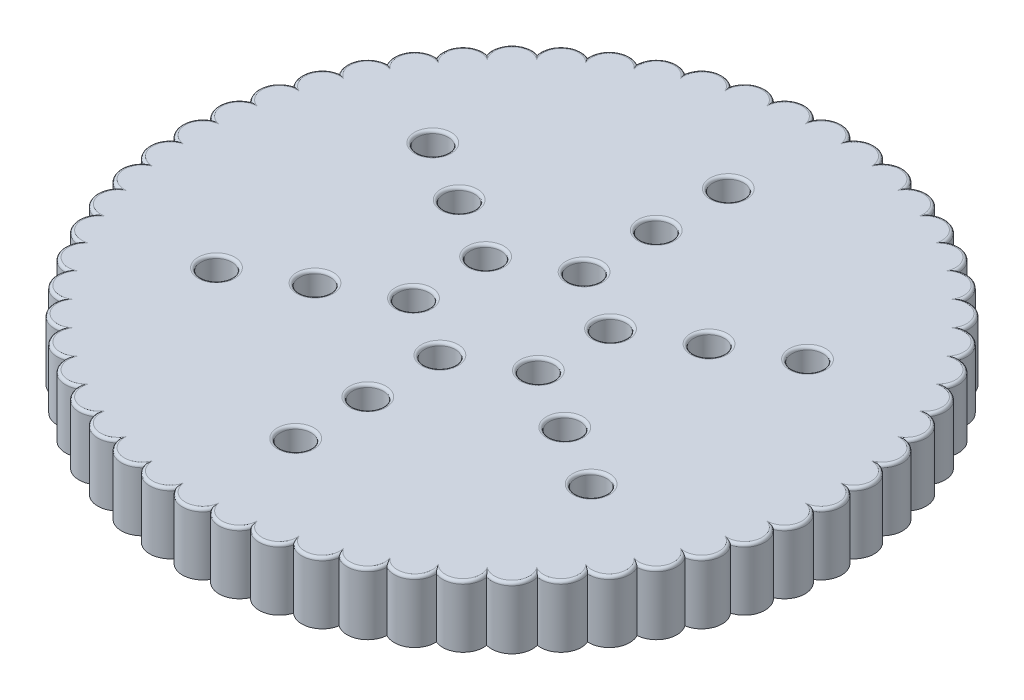
from build123d import *

# Parameters (mm, degrees)
SKETCH1_R           = 0.75
BOSS_EXTRUDE1_DEPTH = 3
FILLET3_R           = 0.14


with BuildPart() as part:
    # Sketch1 → Boss-Extrude1 (new body)
    with BuildSketch(Plane(origin=(0, 0, 0), x_dir=(1, 0, 0), z_dir=(0, 1, 0))):
        with BuildLine():
            ThreePointArc((-15.479945264, 0.869335079), (-15.993021116, 0), (-15.479945264, -0.869335079))
            ThreePointArc((-15.479945264, -0.869335079), (-15.892460356, -1.790650231), (-15.285275971, -2.597072844))
            ThreePointArc((-15.285275971, -2.597072844), (-15.592042686, -3.558781995), (-14.898385463, -4.292150911))
            ThreePointArc((-14.898385463, -4.292150911), (-15.095546032, -5.282160012), (-14.324139114, -5.93325269))
            ThreePointArc((-14.324139114, -5.93325269), (-14.409214129, -6.939111801), (-13.569758405, -7.499740374))
            ThreePointArc((-13.569758405, -7.499740374), (-13.541677997, -8.508800234), (-12.64473011, -8.971914472))
            ThreePointArc((-12.64473011, -8.971914472), (-12.503847408, -9.971485566), (-11.560686998, -10.331261539))
            ThreePointArc((-11.560686998, -10.331261539), (-11.308773682, -11.308773682), (-10.331261539, -11.560686998))
            ThreePointArc((-10.331261539, -11.560686998), (-9.971485566, -12.503847408), (-8.971914472, -12.64473011))
            ThreePointArc((-8.971914472, -12.64473011), (-8.508800234, -13.541677997), (-7.499740374, -13.569758405))
            ThreePointArc((-7.499740374, -13.569758405), (-6.939111801, -14.409214129), (-5.93325269, -14.324139114))
            ThreePointArc((-5.93325269, -14.324139114), (-5.282160012, -15.095546032), (-4.292150911, -14.898385463))
            ThreePointArc((-4.292150911, -14.898385463), (-3.558781995, -15.592042686), (-2.597072844, -15.285275971))
            ThreePointArc((-2.597072844, -15.285275971), (-1.790650231, -15.892460356), (-0.869335079, -15.479945264))
            ThreePointArc((-0.869335079, -15.479945264), (0, -15.993021116), (0.869335079, -15.479945264))
            ThreePointArc((0.869335079, -15.479945264), (1.790650231, -15.892460356), (2.597072844, -15.285275971))
            ThreePointArc((2.597072844, -15.285275971), (3.558781995, -15.592042686), (4.292150911, -14.898385463))
            ThreePointArc((4.292150911, -14.898385463), (5.282160012, -15.095546032), (5.93325269, -14.324139114))
            ThreePointArc((5.93325269, -14.324139114), (6.939111801, -14.409214129), (7.499740374, -13.569758405))
            ThreePointArc((7.499740374, -13.569758405), (8.508800234, -13.541677997), (8.971914472, -12.64473011))
            ThreePointArc((8.971914472, -12.64473011), (9.971485566, -12.503847408), (10.331261539, -11.560686998))
            ThreePointArc((10.331261539, -11.560686998), (11.308773682, -11.308773682), (11.560686998, -10.331261539))
            ThreePointArc((11.560686998, -10.331261539), (12.503847408, -9.971485566), (12.64473011, -8.971914472))
            ThreePointArc((12.64473011, -8.971914472), (13.541677997, -8.508800234), (13.569758405, -7.499740374))
            ThreePointArc((13.569758405, -7.499740374), (14.409214129, -6.939111801), (14.324139114, -5.93325269))
            ThreePointArc((14.324139114, -5.93325269), (15.095546032, -5.282160012), (14.898385463, -4.292150911))
            ThreePointArc((14.898385463, -4.292150911), (15.592042686, -3.558781995), (15.285275971, -2.597072844))
            ThreePointArc((15.285275971, -2.597072844), (15.892460356, -1.790650231), (15.479945264, -0.869335079))
            ThreePointArc((15.479945264, -0.869335079), (15.993021116, 0), (15.479945264, 0.869335079))
            ThreePointArc((15.479945264, 0.869335079), (15.892460356, 1.790650231), (15.285275971, 2.597072844))
            ThreePointArc((15.285275971, 2.597072844), (15.592042686, 3.558781995), (14.898385463, 4.292150911))
            ThreePointArc((14.898385463, 4.292150911), (15.095546032, 5.282160012), (14.324139114, 5.93325269))
            ThreePointArc((14.324139114, 5.93325269), (14.409214129, 6.939111801), (13.569758405, 7.499740374))
            ThreePointArc((13.569758405, 7.499740374), (13.541677997, 8.508800234), (12.64473011, 8.971914472))
            ThreePointArc((12.64473011, 8.971914472), (12.503847408, 9.971485566), (11.560686998, 10.331261539))
            ThreePointArc((11.560686998, 10.331261539), (11.308773682, 11.308773682), (10.331261539, 11.560686998))
            ThreePointArc((10.331261539, 11.560686998), (9.971485566, 12.503847408), (8.971914472, 12.64473011))
            ThreePointArc((8.971914472, 12.64473011), (8.508800234, 13.541677997), (7.499740374, 13.569758405))
            ThreePointArc((7.499740374, 13.569758405), (6.939111801, 14.409214129), (5.93325269, 14.324139114))
            ThreePointArc((5.93325269, 14.324139114), (5.282160012, 15.095546032), (4.292150911, 14.898385463))
            ThreePointArc((4.292150911, 14.898385463), (3.558781995, 15.592042686), (2.597072844, 15.285275971))
            ThreePointArc((2.597072844, 15.285275971), (1.790650231, 15.892460356), (0.869335079, 15.479945264))
            ThreePointArc((0.869335079, 15.479945264), (0, 15.993021116), (-0.869335079, 15.479945264))
            ThreePointArc((-0.869335079, 15.479945264), (-1.790650231, 15.892460356), (-2.597072844, 15.285275971))
            ThreePointArc((-2.597072844, 15.285275971), (-3.558781995, 15.592042686), (-4.292150911, 14.898385463))
            ThreePointArc((-4.292150911, 14.898385463), (-5.282160012, 15.095546032), (-5.93325269, 14.324139114))
            ThreePointArc((-5.93325269, 14.324139114), (-6.939111801, 14.409214129), (-7.499740374, 13.569758405))
            ThreePointArc((-7.499740374, 13.569758405), (-8.508800234, 13.541677997), (-8.971914472, 12.64473011))
            ThreePointArc((-8.971914472, 12.64473011), (-9.971485566, 12.503847408), (-10.331261539, 11.560686998))
            ThreePointArc((-10.331261539, 11.560686998), (-11.308773682, 11.308773682), (-11.560686998, 10.331261539))
            ThreePointArc((-11.560686998, 10.331261539), (-12.503847408, 9.971485566), (-12.64473011, 8.971914472))
            ThreePointArc((-12.64473011, 8.971914472), (-13.541677997, 8.508800234), (-13.569758405, 7.499740374))
            ThreePointArc((-13.569758405, 7.499740374), (-14.409214129, 6.939111801), (-14.324139114, 5.93325269))
            ThreePointArc((-14.324139114, 5.93325269), (-15.095546032, 5.282160012), (-14.898385463, 4.292150911))
            ThreePointArc((-14.898385463, 4.292150911), (-15.592042686, 3.558781995), (-15.285275971, 2.597072844))
            ThreePointArc((-15.285275971, 2.597072844), (-15.892460356, 1.790650231), (-15.479945264, 0.869335079))
        make_face()
        with Locations((0, 10.5)):
            Circle(SKETCH1_R, mode=Mode.SUBTRACT)
        with Locations((0, 7)):
            Circle(SKETCH1_R, mode=Mode.SUBTRACT)
        with Locations((0, 3.5)):
            Circle(SKETCH1_R, mode=Mode.SUBTRACT)
        with Locations((3.031088913, 1.75)):
            Circle(SKETCH1_R, mode=Mode.SUBTRACT)
        with Locations((6.062177826, 3.5)):
            Circle(SKETCH1_R, mode=Mode.SUBTRACT)
        with Locations((9.09326674, 5.25)):
            Circle(SKETCH1_R, mode=Mode.SUBTRACT)
        with Locations((3.031088913, -1.75)):
            Circle(SKETCH1_R, mode=Mode.SUBTRACT)
        with Locations((6.062177826, -3.5)):
            Circle(SKETCH1_R, mode=Mode.SUBTRACT)
        with Locations((9.09326674, -5.25)):
            Circle(SKETCH1_R, mode=Mode.SUBTRACT)
        with Locations((0, -3.5)):
            Circle(SKETCH1_R, mode=Mode.SUBTRACT)
        with Locations((0, -7)):
            Circle(SKETCH1_R, mode=Mode.SUBTRACT)
        with Locations((0, -10.5)):
            Circle(SKETCH1_R, mode=Mode.SUBTRACT)
        with Locations((-3.031088913, -1.75)):
            Circle(SKETCH1_R, mode=Mode.SUBTRACT)
        with Locations((-6.062177826, -3.5)):
            Circle(SKETCH1_R, mode=Mode.SUBTRACT)
        with Locations((-9.09326674, -5.25)):
            Circle(SKETCH1_R, mode=Mode.SUBTRACT)
        with Locations((-3.031088913, 1.75)):
            Circle(SKETCH1_R, mode=Mode.SUBTRACT)
        with Locations((-6.062177826, 3.5)):
            Circle(SKETCH1_R, mode=Mode.SUBTRACT)
        with Locations((-9.09326674, 5.25)):
            Circle(SKETCH1_R, mode=Mode.SUBTRACT)
    extrude(amount=BOSS_EXTRUDE1_DEPTH)

    # Fillet3
    fillet3_edges = [part.edges().sort_by_distance(p)[0] for p in [
        (-3.781088913, 3, -1.75),
        (-9.84326674, 3, -5.25),
        (-6.812177826, 3, 3.5),
        (-0.75, 3, 3.5),
        (-0.75, 3, 10.5),
        (5.312177826, 3, 3.5),
        (2.281088913, 3, -1.75),
        (8.34326674, 3, -5.25),
        (-0.75, 3, -7),
        (-15.993021116, 3, 0),
        (-15.892460356, 3, -1.790650231),
        (-15.592042686, 3, -3.558781995),
        (-15.095546032, 3, -5.282160012),
        (-14.409214129, 3, -6.939111801),
        (-13.541677997, 3, -8.508800234),
        (-12.503847408, 3, -9.971485566),
        (-11.308773682, 3, -11.308773682),
        (-9.971485566, 3, -12.503847408),
        (-8.508800234, 3, -13.541677997),
        (-6.939111801, 3, -14.409214129),
        (-5.282160012, 3, -15.095546032),
        (-3.558781995, 3, -15.592042686),
        (-1.790650231, 3, -15.892460356),
        (0, 3, -15.993021116),
        (1.790650231, 3, -15.892460356),
        (3.558781995, 3, -15.592042686),
        (5.282160012, 3, -15.095546032),
        (6.939111801, 3, -14.409214129),
        (8.508800234, 3, -13.541677997),
        (9.971485566, 3, -12.503847408),
        (11.308773682, 3, -11.308773682),
        (12.503847408, 3, -9.971485566),
        (13.541677997, 3, -8.508800234),
        (14.409214129, 3, -6.939111801),
        (15.095546032, 3, -5.282160012),
        (15.592042686, 3, -3.558781995),
        (15.892460356, 3, -1.790650231),
        (15.993021116, 3, 0),
        (15.892460356, 3, 1.790650231),
        (15.592042686, 3, 3.558781995),
        (15.095546032, 3, 5.282160012),
        (14.409214129, 3, 6.939111801),
        (13.541677997, 3, 8.508800234),
        (12.503847408, 3, 9.971485566),
        (11.308773682, 3, 11.308773682),
        (9.971485566, 3, 12.503847408),
        (8.508800234, 3, 13.541677997),
        (6.939111801, 3, 14.409214129),
        (5.282160012, 3, 15.095546032),
        (3.558781995, 3, 15.592042686),
        (1.790650231, 3, 15.892460356),
        (0, 3, 15.993021116),
        (-1.790650231, 3, 15.892460356),
        (-3.558781995, 3, 15.592042686),
        (-5.282160012, 3, 15.095546032),
        (-6.939111801, 3, 14.409214129),
        (-8.508800234, 3, 13.541677997),
        (-9.971485566, 3, 12.503847408),
        (-11.308773682, 3, 11.308773682),
        (-12.503847408, 3, 9.971485566),
        (-13.541677997, 3, 8.508800234),
        (-14.409214129, 3, 6.939111801),
        (-15.095546032, 3, 5.282160012),
        (-15.592042686, 3, 3.558781995),
        (-15.892460356, 3, 1.790650231),
        (-0.75, 3, -10.5),
        (-0.75, 3, -3.5),
        (5.312177826, 3, -3.5),
        (8.34326674, 3, 5.25),
        (2.281088913, 3, 1.75),
        (-0.75, 3, 7),
        (-9.84326674, 3, 5.25),
        (-3.781088913, 3, 1.75),
        (-6.812177826, 3, -3.5),
    ]]
    fillet(fillet3_edges, radius=FILLET3_R)


solid = part.part
